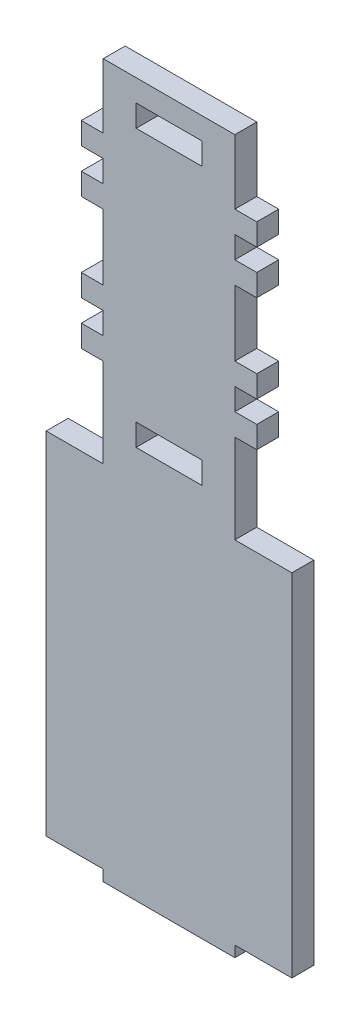
from build123d import *

# Parameters (mm, degrees)
SKETCH1_W           = 19.05
SKETCH1_H           = 6.35
BOSS_EXTRUDE1_DEPTH = 6.35
CUT_EXTRUDE1_DEPTH  = 6.35


with BuildPart() as part:
    # Sketch1 → Boss-Extrude1 (new body)
    with BuildSketch(Plane.XY):
        Polygon((19.05, -1.5875), (-19.05, -1.5875), (-19.05, 1.5875), (-35.56, 1.5875), (-35.56, 204.7875), (35.56, 204.7875), (35.56, 1.5875), (19.05, 1.5875), align=None)
        with Locations((0, 195.2625)):
            Rectangle(SKETCH1_W, SKETCH1_H, mode=Mode.SUBTRACT)
        with Locations((0, 115.2525)):
            Rectangle(SKETCH1_W, SKETCH1_H, mode=Mode.SUBTRACT)
    extrude(amount=BOSS_EXTRUDE1_DEPTH)

    # Sketch3 → Cut-Extrude1 (cut)
    with BuildSketch(Plane(origin=(0, 0, 0), x_dir=(-1, 0, 0), z_dir=(0, 0, -1))):
        Polygon((-35.56, 204.7875), (-19.05, 204.7875), (-19.05, 186.108405272), (-25.4, 186.108405272), (-25.4, 179.758405272), (-19.05, 179.758405272), (-19.05, 173.408405272), (-25.4, 173.408405272), (-25.4, 167.058405272), (-19.05, 167.058405272), (-19.05, 148.008405272), (-25.4, 148.008405272), (-25.4, 141.658405272), (-19.05, 141.658405272), (-19.05, 135.308405272), (-25.4, 135.308405272), (-25.4, 128.958405272), (-19.05, 128.958405272), (-19.05, 103.1875), (-35.56, 103.1875), align=None)
        Polygon((35.56, 103.1875), (19.05, 103.1875), (19.05, 128.958405272), (25.4, 128.958405272), (25.4, 135.308405272), (19.05, 135.308405272), (19.05, 141.658405272), (25.4, 141.658405272), (25.4, 148.008405272), (19.05, 148.008405272), (19.05, 167.058405272), (25.4, 167.058405272), (25.4, 173.408405272), (19.05, 173.408405272), (19.05, 179.758405272), (25.4, 179.758405272), (25.4, 186.108405272), (19.05, 186.108405272), (19.05, 204.7875), (35.56, 204.7875), align=None)
    extrude(amount=-CUT_EXTRUDE1_DEPTH, mode=Mode.SUBTRACT)


solid = part.part
